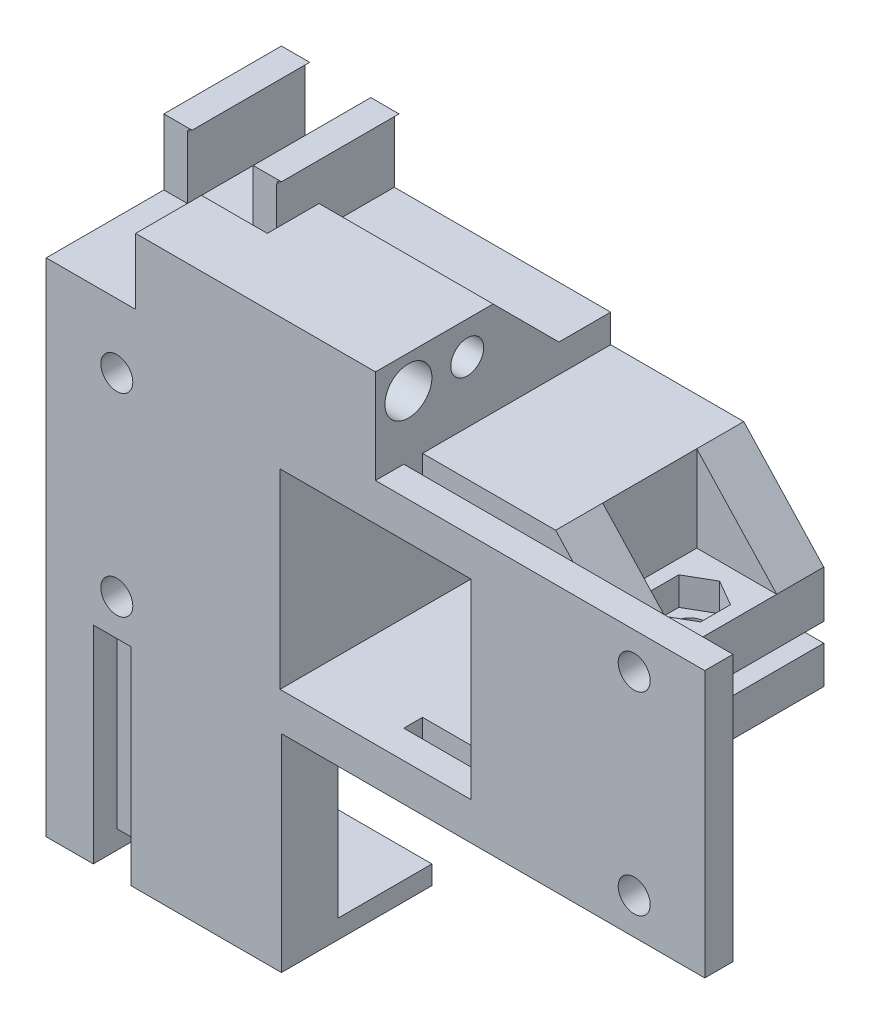
from build123d import *

# Parameters (mm, degrees)
ESQUISSE1_W                = 28.3
ESQUISSE1_H                = 28.3
ESQUISSE1_W_2              = 20.3
ESQUISSE1_H_2              = 20.3
BOSS_EXTRU_1_DEPTH         = 20
BOSS_EXTRU_7_DEPTH         = 20
ESQUISSE2_W                = 8.5
ESQUISSE2_H                = 20
ESQUISSE2_R                = 1.7
BOSS_EXTRU_2_DEPTH         = 2
ESQUISSE2_3_W              = 8.5
ESQUISSE2_3_H              = 20
BOSS_EXTRU_3_DEPTH         = 3
ESQUISSE3_W                = 8.5
ESQUISSE3_H                = 20
ESQUISSE3_R                = 1.7
BOSS_EXTRU_4_DEPTH         = 2
ESQUISSE5_W                = 8.5
ESQUISSE5_H                = 20
ESQUISSE5_R                = 3
BOSS_EXTRU_5_DEPTH         = 2
BOSS_EXTRU_6_DEPTH         = 20
BOSS_EXTRU_6_DEPTH_BACK    = 20
ESQUISSE6_W                = 28.3
ESQUISSE6_H                = 28.3
ESQUISSE6_W_2              = 15.3
ESQUISSE6_H_2              = 15.3
ENL_V_MAT_EXTRU_1_REACH    = 68.678
ESQUISSE7_W                = 6.5
ESQUISSE7_H                = 2
ENL_V_MAT_EXTRU_2_REACH    = 65.341
ESQUISSE8_W                = 14.15
ESQUISSE8_H                = 2
ESQUISSE9_W                = 8.5
ESQUISSE9_H                = 40
BOSS_EXTRU_8_DEPTH         = 5
ESQUISSE9_4_R              = 1.7
BOSS_EXTRU_9_DEPTH         = 2
BOSS_EXTRU_10_START        = -2
ESQUISSE10_W               = 8.5
ESQUISSE10_H               = 40
ESQUISSE10_R               = 1.7
BOSS_EXTRU_10_DEPTH        = 2
ESQUISSE11_W               = 8.5
ESQUISSE11_H               = 40
ESQUISSE11_R               = 3
BOSS_EXTRU_11_DEPTH        = 2
NERVURE4_REACH             = 68.678
ESQUISSE14_WALL_W          = 147.131281186
ESQUISSE14_WALL_H          = 5
NERVURE10_REACH            = 68.678
ESQUISSE16_WALL_W          = 147.844247416
ESQUISSE16_WALL_H          = 5
R_P_TITION_LIN_AIRE1_COUNT = 3
R_P_TITION_LIN_AIRE1_PITCH = 17.5
NERVURE11_REACH            = 76.685
ESQUISSE17_WALL_W          = 163.85974229
ESQUISSE17_WALL_H          = 5
NERVURE17_REACH            = 58.973
ESQUISSE19_WALL_W          = 127.721749296
ESQUISSE19_WALL_H          = 5
R_P_TITION_LIN_AIRE2_COUNT = 2
R_P_TITION_LIN_AIRE2_PITCH = 15
R_P_TITION_LIN_AIRE3_COUNT = 2
R_P_TITION_LIN_AIRE3_PITCH = 15
ENL_V_MAT_EXTRU_3_REACH    = 57.288
ESQUISSE20_W               = 77.833771897
ESQUISSE20_H               = 63.25162408
ESQUISSE21_W               = 14.15
ESQUISSE21_H               = 3.85
BOSS_EXTRU_12_DEPTH        = 3
BOSS_EXTRU_13_START        = 3
ESQUISSE23_W               = 20.85
ESQUISSE23_H               = 28.3
ESQUISSE23_R               = 1.7
BOSS_EXTRU_13_DEPTH        = 3
ESQUISSE24_W               = 25
ESQUISSE24_H               = 22
BOSS_EXTRU_14_DEPTH        = 6
ESQUISSE25_W               = 22
ESQUISSE25_H               = 18
ENL_V_MAT_EXTRU_4_DEPTH    = 2
ENL_V_MAT_EXTRU_5_REACH    = 55.785
ESQUISSE26_W               = 4
ESQUISSE26_H               = 2
ENL_V_MAT_EXTRU_6_REACH    = 64.912
ESQUISSE27_W               = 4
ESQUISSE27_H               = 2.5
ESQUISSE28_W               = 16
ESQUISSE28_H               = 2
ESQUISSE28_W_2             = 5
BOSS_EXTRU_15_DEPTH        = 10
ESQUISSE29_W               = 5
ESQUISSE29_H               = 2
ENL_V_MAT_EXTRU_7_DEPTH    = 2
ESQUISSE30_W               = 35
ESQUISSE30_H               = 25
BOSS_EXTRU_16_DEPTH        = 3
ESQUISSE31_W               = 2.5
ESQUISSE31_H               = 12.5
ESQUISSE31_W_2             = 18.5
ESQUISSE31_H_2             = 5.5
BOSS_EXTRU_17_DEPTH        = 7
ESQUISSE32_R               = 1.75
ESQUISSE32_R_2             = 2.5
ENL_V_MAT_EXTRU_8_DEPTH    = 74.260306442
CHANFREIN1_SIZE            = 7
BOSS_EXTRU_18_DEPTH        = 12.5


with BuildPart() as part:
    # Esquisse1 → Boss.-Extru.1 (new body)
    with BuildSketch(Plane.XY):
        Rectangle(ESQUISSE1_W, ESQUISSE1_H)
        Rectangle(ESQUISSE1_W_2, ESQUISSE1_H_2, mode=Mode.SUBTRACT)
    extrude(amount=BOSS_EXTRU_1_DEPTH)

    # Esquisse1<3> → Boss.-Extru.7 (add)
    with BuildSketch(Plane.XY):
        Polygon((14.15, 14.15), (-14.15, 14.15), (-14.15, -14.15), (14.15, -14.15), (14.15, -2), (10.15, -2), (10.15, -10.15), (-10.15, -10.15), (-10.15, 10.15), (10.15, 10.15), (10.15, 0), (14.15, 0), align=None)
    extrude(amount=-BOSS_EXTRU_7_DEPTH)

    # Esquisse2 → Boss.-Extru.2 (add)
    with BuildSketch(Plane(origin=(0, 2, 0), x_dir=(-1, 0, 0), z_dir=(0, -1, 0))):
        with Locations((-18.4, 10)):
            Rectangle(ESQUISSE2_W, ESQUISSE2_H)
        with Locations(Location((-18.4, 10, 0), (0, 0, 180))):
            Circle(ESQUISSE2_R, mode=Mode.SUBTRACT)
    extrude(amount=BOSS_EXTRU_2_DEPTH)

    # Esquisse2<3> → Boss.-Extru.3 (add)
    with BuildSketch(Plane(origin=(0, 2, 0), x_dir=(-1, 0, 0), z_dir=(0, -1, 0))):
        with Locations((-18.4, 10)):
            Rectangle(ESQUISSE2_3_W, ESQUISSE2_3_H)
        Polygon((-15.65, 11.58771324), (-15.65, 8.41228676), (-18.4, 6.824573519), (-21.15, 8.41228676), (-21.15, 11.58771324), (-18.4, 13.175426481), align=None, mode=Mode.SUBTRACT)
    extrude(amount=-BOSS_EXTRU_3_DEPTH)

    # Esquisse3 → Boss.-Extru.4 (add)
    with BuildSketch(Plane(origin=(0, -2, 0), x_dir=(1, 0, 0), z_dir=(0, 1, 0))):
        with Locations((18.4, 10)):
            Rectangle(ESQUISSE3_W, ESQUISSE3_H)
        with Locations((18.4, 10)):
            Circle(ESQUISSE3_R, mode=Mode.SUBTRACT)
    extrude(amount=-BOSS_EXTRU_4_DEPTH)

    # Esquisse5 → Boss.-Extru.5 (add)
    with BuildSketch(Plane.XZ.offset(4)):
        with Locations((18.4, -10)):
            Rectangle(ESQUISSE5_W, ESQUISSE5_H)
        with Locations((18.4, -10)):
            Circle(ESQUISSE5_R, mode=Mode.SUBTRACT)
    extrude(amount=BOSS_EXTRU_5_DEPTH)

    # Esquisse6 → Boss.-Extru.6 (add, two sides: drawn at the far end of the back side and taken through both)
    with BuildSketch(Plane(origin=(0, 0, 0), x_dir=(-1, 0, 0), z_dir=(0, -1, 0)).offset(-BOSS_EXTRU_6_DEPTH_BACK)):
        with Locations((0, -34.15)):
            Rectangle(ESQUISSE6_W, ESQUISSE6_H)
        with Locations((0, -34.15)):
            Rectangle(ESQUISSE6_W_2, ESQUISSE6_H_2, mode=Mode.SUBTRACT)
    extrude(amount=BOSS_EXTRU_6_DEPTH + BOSS_EXTRU_6_DEPTH_BACK)

    # Esquisse7 → Enlèv. mat.-Extru.1 (cut, up to next)
    with BuildSketch(Plane.XZ.offset(20), mode=Mode.PRIVATE) as enl_v_mat_extru_1_sk1:
        with Locations((10.9, 35.15)):
            Rectangle(ESQUISSE7_W, ESQUISSE7_H)
    enl_v_mat_extru_1_tool1 = extrude(enl_v_mat_extru_1_sk1.sketch, amount=-ENL_V_MAT_EXTRU_1_REACH, mode=Mode.PRIVATE) & part.part
    add(enl_v_mat_extru_1_tool1.solids().sort_by_distance((10.9, -20, 35.15))[0], mode=Mode.SUBTRACT)

    # Esquisse8 → Enlèv. mat.-Extru.2 (cut, up to next)
    with BuildSketch(Plane.XZ.offset(14.15), mode=Mode.PRIVATE) as enl_v_mat_extru_2_sk1:
        with Locations((7.075, 1)):
            Rectangle(ESQUISSE8_W, ESQUISSE8_H)
    enl_v_mat_extru_2_tool1 = extrude(enl_v_mat_extru_2_sk1.sketch, amount=-ENL_V_MAT_EXTRU_2_REACH, mode=Mode.PRIVATE) & part.part
    add(enl_v_mat_extru_2_tool1.solids().sort_by_distance((7.075, -14.15, 1))[0], mode=Mode.SUBTRACT)

    # Esquisse9 → Boss.-Extru.8 (add)
    with BuildSketch(Plane.XY.offset(34.15)):
        with Locations((18.4, 0)):
            Rectangle(ESQUISSE9_W, ESQUISSE9_H)
        Polygon((18.4, 6.824573519), (21.15, 8.41228676), (21.15, 11.58771324), (18.4, 13.175426481), (15.65, 11.58771324), (15.65, 8.41228676), align=None, mode=Mode.SUBTRACT)
        Polygon((18.4, -6.824573519), (21.15, -8.41228676), (21.15, -11.58771324), (18.4, -13.175426481), (15.65, -11.58771324), (15.65, -8.41228676), align=None, mode=Mode.SUBTRACT)
    extrude(amount=-BOSS_EXTRU_8_DEPTH)

    # Esquisse9<4> → Boss.-Extru.9 (add)
    # profile 1 of 2: a face of its own
    with BuildSketch(Plane.XY.offset(34.15)):
        Polygon((15.65, 8.41228676), (18.4, 6.824573519), (21.15, 8.41228676), (21.15, 11.58771324), (18.4, 13.175426481), (15.65, 11.58771324), align=None)
        with Locations((18.4, 10)):
            Circle(ESQUISSE9_4_R, mode=Mode.SUBTRACT)
    # profile 2 of 2: a face of its own
    with BuildSketch(Plane.XY.offset(34.15)):
        Polygon((21.15, -8.41228676), (21.15, -11.58771324), (18.4, -13.175426481), (15.65, -11.58771324), (15.65, -8.41228676), (18.4, -6.824573519), align=None)
        with Locations((18.4, -10)):
            Circle(ESQUISSE9_4_R, mode=Mode.SUBTRACT)
    extrude(amount=-BOSS_EXTRU_9_DEPTH)

    # Esquisse10 → Boss.-Extru.10 (add)
    with BuildSketch(Plane(origin=(0, 0, 36.15), x_dir=(-1, 0, 0), z_dir=(0, 0, -1)).offset(BOSS_EXTRU_10_START)):
        with Locations((-18.4, 0)):
            Rectangle(ESQUISSE10_W, ESQUISSE10_H)
        with Locations(Location((-18.4, -10, 0), (0, 0, 180))):
            Circle(ESQUISSE10_R, mode=Mode.SUBTRACT)
        with Locations(Location((-18.4, 10, 0), (0, 0, 180))):
            Circle(ESQUISSE10_R, mode=Mode.SUBTRACT)
    extrude(amount=BOSS_EXTRU_10_DEPTH)

    # Esquisse11 → Boss.-Extru.11 (add)
    with BuildSketch(Plane.XY.offset(38.15)):
        with Locations((18.4, 0)):
            Rectangle(ESQUISSE11_W, ESQUISSE11_H)
        with Locations((18.4, 10)):
            Circle(ESQUISSE11_R, mode=Mode.SUBTRACT)
        with Locations((18.4, -10)):
            Circle(ESQUISSE11_R, mode=Mode.SUBTRACT)
    extrude(amount=BOSS_EXTRU_11_DEPTH)

    # Esquisse14 wall → Nervure4 (add, up to next)
    with BuildSketch(Plane(origin=(18.4, -20, 44.225), x_dir=(0.721811427095, 0, -0.692089780097), z_dir=(0.692089780097, 0, 0.721811427095)), mode=Mode.PRIVATE) as nervure4_sk1:
        with Locations((0, 2.5)):
            Rectangle(ESQUISSE14_WALL_W, ESQUISSE14_WALL_H)
    nervure4_tool1 = extrude(nervure4_sk1.sketch, amount=-NERVURE4_REACH, mode=Mode.PRIVATE) - part.part
    nervure4 = nervure4_tool1.solids().sort_by_distance((18.4, -20, 44.225))[0]
    add(nervure4)

    # Esquisse16 wall → Nervure10 (add, up to next)
    with BuildSketch(Plane(origin=(18.4, -20, 24.575), x_dir=(-0.680604645507, 0, -0.732650883105), z_dir=(0.732650883105, 0, -0.680604645507)), mode=Mode.PRIVATE) as nervure10_sk1:
        with Locations((0, 2.5)):
            Rectangle(ESQUISSE16_WALL_W, ESQUISSE16_WALL_H)
    nervure10_tool1 = extrude(nervure10_sk1.sketch, amount=-NERVURE10_REACH, mode=Mode.PRIVATE) - part.part
    nervure10 = nervure10_tool1.solids().sort_by_distance((18.4, -20, 24.575))[0]
    add(nervure10)

    # Répétition linéaire1: Nervure4, Nervure10 ×3
    with Locations(*[(0, i * R_P_TITION_LIN_AIRE1_PITCH, 0) for i in range(1, R_P_TITION_LIN_AIRE1_COUNT)]):
        add(nervure4)
        add(nervure10)

    # Esquisse17 wall → Nervure11 (add, up to next)
    with BuildSketch(Plane(origin=(18.4, 9.575, -20), x_dir=(-0.680604645507, 0.732650883105, 0), z_dir=(0.732650883105, 0.680604645507, 0)), mode=Mode.PRIVATE) as nervure11_sk1:
        with Locations((0, 2.5)):
            Rectangle(ESQUISSE17_WALL_W, ESQUISSE17_WALL_H)
    nervure11_tool1 = extrude(nervure11_sk1.sketch, amount=-NERVURE11_REACH, mode=Mode.PRIVATE) - part.part
    nervure11 = nervure11_tool1.solids().sort_by_distance((18.4, 9.575, -20))[0]
    add(nervure11)

    # Esquisse19 wall → Nervure17 (add, up to next)
    with BuildSketch(Plane(origin=(18.4, -10.075, 0), x_dir=(-0.721811427095, -0.692089780097, 0), z_dir=(0.692089780097, -0.721811427095, 0)), mode=Mode.PRIVATE) as nervure17_sk1:
        with Locations((0, 2.5)):
            Rectangle(ESQUISSE19_WALL_W, ESQUISSE19_WALL_H)
    nervure17_tool1 = extrude(nervure17_sk1.sketch, amount=-NERVURE17_REACH, mode=Mode.PRIVATE) - part.part
    nervure17 = nervure17_tool1.solids().sort_by_distance((18.4, -10.075, 0))[0]
    add(nervure17)

    # Répétition linéaire2: Nervure17 ×2
    with Locations(*[(0, 0, -i * R_P_TITION_LIN_AIRE2_PITCH) for i in range(1, R_P_TITION_LIN_AIRE2_COUNT)]):
        add(nervure17)

    # Répétition linéaire3: Nervure11 ×2
    with Locations(*[(0, 0, i * R_P_TITION_LIN_AIRE3_PITCH) for i in range(1, R_P_TITION_LIN_AIRE3_COUNT)]):
        add(nervure11)

    # Esquisse20 → Enlèv. mat.-Extru.3 (cut, up to next)
    with BuildSketch(Plane(origin=(0, 0, 2), x_dir=(-1, 0, 0), z_dir=(0, 0, -1)), mode=Mode.PRIVATE) as enl_v_mat_extru_3_sk1:
        with Locations((6.593135557, -7.228757038)):
            Rectangle(ESQUISSE20_W, ESQUISSE20_H)
    enl_v_mat_extru_3_tool1 = extrude(enl_v_mat_extru_3_sk1.sketch, amount=-ENL_V_MAT_EXTRU_3_REACH, mode=Mode.PRIVATE) & part.part
    add(enl_v_mat_extru_3_tool1.solids().sort_by_distance((-6.593136, -7.228757, 2))[0], mode=Mode.SUBTRACT)

    # Esquisse21 → Boss.-Extru.12 (add)
    with BuildSketch(Plane.XY.offset(2)):
        with BuildLine():
            ThreePointArc((-27.5, 8.6), (-28.702081528, 11.502081528), (-25.8, 10.3))
            Line((-25.8, 10.3), (-14.15, 10.3))
            Line((-14.15, 10.3), (-14.15, 14.15))
            Line((-14.15, 14.15), (-35, 14.15))
            Line((-35, 14.15), (-35, -14.15))
            Line((-35, -14.15), (-14.15, -14.15))
            Line((-14.15, -14.15), (-14.15, -10.3))
            Line((-14.15, -10.3), (-25.8, -10.3))
            ThreePointArc((-25.8, -10.3), (-28.702081528, -11.502081528), (-27.5, -8.6))
            Line((-27.5, -8.6), (-27.5, 8.6))
        make_face()
        with BuildLine():
            Line((-14.15, 10.3), (-25.8, 10.3))
            ThreePointArc((-25.8, 10.3), (-26.297918472, 9.097918472), (-27.5, 8.6))
            Line((-27.5, 8.6), (-27.5, -8.6))
            ThreePointArc((-27.5, -8.6), (-26.297918472, -9.097918472), (-25.8, -10.3))
            Line((-25.8, -10.3), (-14.15, -10.3))
            Line((-14.15, -10.3), (-14.15, 10.3))
        make_face()
        with BuildLine():
            Line((0, 14.15), (0, 10.3))
            Line((0, 10.3), (25.8, 10.3))
            ThreePointArc((25.8, 10.3), (27.5, 12), (29.2, 10.3))
            ThreePointArc((29.2, 10.3), (28.702081528, 9.097918472), (27.5, 8.6))
            Line((27.5, 8.6), (27.5, -8.6))
            ThreePointArc((27.5, -8.6), (28.702081528, -9.097918472), (29.2, -10.3))
            ThreePointArc((29.2, -10.3), (27.5, -12), (25.8, -10.3))
            Line((25.8, -10.3), (0, -10.3))
            Line((0, -10.3), (0, -14.15))
            Line((0, -14.15), (35, -14.15))
            Line((35, -14.15), (35, 14.15))
            Line((35, 14.15), (0, 14.15))
        make_face()
        with Locations((-7.075, 12.225)):
            Rectangle(ESQUISSE21_W, ESQUISSE21_H)
        Polygon((0, 10.3), (-14.15, 10.3), (-14.15, -10.3), (0, -10.3), (0, -10.15), (-10.15, -10.15), (-10.15, 10.15), (0, 10.15), align=None)
        with Locations((-7.075, -12.225)):
            Rectangle(ESQUISSE21_W, ESQUISSE21_H)
        with BuildLine():
            Line((25.8, 10.3), (0, 10.3))
            Line((0, 10.3), (0, 10.15))
            Line((0, 10.15), (10.15, 10.15))
            Line((10.15, 10.15), (10.15, -10.15))
            Line((10.15, -10.15), (0, -10.15))
            Line((0, -10.15), (0, -10.3))
            Line((0, -10.3), (25.8, -10.3))
            ThreePointArc((25.8, -10.3), (26.297918472, -9.097918472), (27.5, -8.6))
            Line((27.5, -8.6), (27.5, 8.6))
            ThreePointArc((27.5, 8.6), (26.297918472, 9.097918472), (25.8, 10.3))
        make_face()
    extrude(amount=BOSS_EXTRU_12_DEPTH)

    # Esquisse23 → Boss.-Extru.13 (add)
    with BuildSketch(Plane(origin=(0, 0, 2), x_dir=(-1, 0, 0), z_dir=(0, 0, -1)).offset(BOSS_EXTRU_13_START)):
        with Locations((24.575, 0)):
            Rectangle(ESQUISSE23_W, ESQUISSE23_H)
        with Locations((27.5, 10.3)):
            Circle(ESQUISSE23_R, mode=Mode.SUBTRACT)
        with Locations((27.5, -10.3)):
            Circle(ESQUISSE23_R, mode=Mode.SUBTRACT)
    extrude(amount=-BOSS_EXTRU_13_DEPTH)

    # Esquisse24 → Boss.-Extru.14 (add)
    with BuildSketch(Plane.XY.offset(5)):
        with Locations((-22.5, -25.15)):
            Rectangle(ESQUISSE24_W, ESQUISSE24_H)
    extrude(amount=-BOSS_EXTRU_14_DEPTH)

    # Esquisse25 → Enlèv. mat.-Extru.4 (cut)
    with BuildSketch(Plane(origin=(0, 0, -1), x_dir=(-1, 0, 0), z_dir=(0, 0, -1))):
        with Locations((22, -25.15)):
            Rectangle(ESQUISSE25_W, ESQUISSE25_H)
    extrude(amount=-ENL_V_MAT_EXTRU_4_DEPTH, mode=Mode.SUBTRACT)

    # Esquisse26 → Enlèv. mat.-Extru.5 (cut, up to next)
    with BuildSketch(Plane(origin=(0, 0, -1), x_dir=(-1, 0, 0), z_dir=(0, 0, -1)), mode=Mode.PRIVATE) as enl_v_mat_extru_5_sk1:
        with Locations((28, -15.15)):
            Rectangle(ESQUISSE26_W, ESQUISSE26_H)
    enl_v_mat_extru_5_tool1 = extrude(enl_v_mat_extru_5_sk1.sketch, amount=-ENL_V_MAT_EXTRU_5_REACH, mode=Mode.PRIVATE) & part.part
    # Esquisse26 → Enlèv. mat.-Extru.5 (cut, up to next)
    with BuildSketch(Plane(origin=(0, 0, -1), x_dir=(-1, 0, 0), z_dir=(0, 0, -1)), mode=Mode.PRIVATE) as enl_v_mat_extru_5_sk2:
        with Locations((28, -35.15)):
            Rectangle(ESQUISSE26_W, ESQUISSE26_H)
    enl_v_mat_extru_5_tool2 = extrude(enl_v_mat_extru_5_sk2.sketch, amount=-ENL_V_MAT_EXTRU_5_REACH, mode=Mode.PRIVATE) & part.part
    add(enl_v_mat_extru_5_tool1.solids().sort_by_distance((-28, -15.15, -1))[0], mode=Mode.SUBTRACT)
    add(enl_v_mat_extru_5_tool2.solids().sort_by_distance((-28, -35.15, -1))[0], mode=Mode.SUBTRACT)

    # Esquisse27 → Enlèv. mat.-Extru.6 (cut, up to next)
    with BuildSketch(Plane.XZ.offset(34.15), mode=Mode.PRIVATE) as enl_v_mat_extru_6_sk1:
        with Locations((-28, 3.75)):
            Rectangle(ESQUISSE27_W, ESQUISSE27_H)
    enl_v_mat_extru_6_tool1 = extrude(enl_v_mat_extru_6_sk1.sketch, amount=-ENL_V_MAT_EXTRU_6_REACH, mode=Mode.PRIVATE) & part.part
    add(enl_v_mat_extru_6_tool1.solids().sort_by_distance((-28, -34.15, 3.75))[0], mode=Mode.SUBTRACT)

    # Esquisse28 → Boss.-Extru.15 (add)
    with BuildSketch(Plane(origin=(0, 0, -1), x_dir=(-1, 0, 0), z_dir=(0, 0, -1))):
        with Locations((18, -15.15)):
            Rectangle(ESQUISSE28_W, ESQUISSE28_H)
        with Locations((32.5, -15.15)):
            Rectangle(ESQUISSE28_W_2, ESQUISSE28_H)
        with Locations((32.5, -35.15)):
            Rectangle(ESQUISSE28_W_2, ESQUISSE28_H)
        with Locations((18, -35.15)):
            Rectangle(ESQUISSE28_W, ESQUISSE28_H)
    extrude(amount=BOSS_EXTRU_15_DEPTH)

    # Esquisse29 → Enlèv. mat.-Extru.7 (cut)
    with BuildSketch(Plane(origin=(0, 0, -11), x_dir=(-1, 0, 0), z_dir=(0, 0, -1))):
        with Locations((32.5, -35.15)):
            Rectangle(ESQUISSE29_W, ESQUISSE29_H)
    extrude(amount=-ENL_V_MAT_EXTRU_7_DEPTH, mode=Mode.SUBTRACT)

    # Esquisse30 → Boss.-Extru.16 (add)
    with BuildSketch(Plane(origin=(0, 14.15, 0), x_dir=(1, 0, 0), z_dir=(0, 1, 0))):
        with Locations((-17.5, 7.5)):
            Rectangle(ESQUISSE30_W, ESQUISSE30_H)
    extrude(amount=BOSS_EXTRU_16_DEPTH)

    # Esquisse31 → Boss.-Extru.17 (add)
    with BuildSketch(Plane(origin=(0, 17.15, 0), x_dir=(1, 0, 0), z_dir=(0, 1, 0))):
        with Locations((-33.75, 13.75)):
            Rectangle(ESQUISSE31_W, ESQUISSE31_H)
        with Locations((-24.25, 13.75)):
            Rectangle(ESQUISSE31_W, ESQUISSE31_H)
        with Locations((-9.25, 4.75)):
            Rectangle(ESQUISSE31_W_2, ESQUISSE31_H_2)
        Polygon((-25.5, 2), (-25.5, -5), (0, -5), (0, 2), (-18.5, 2), align=None)
    extrude(amount=BOSS_EXTRU_17_DEPTH)

    # Esquisse32 → Enlèv. mat.-Extru.8 (cut, through all)
    with BuildSketch(Plane.ZY.offset(25.5)):
        with Locations(Location((-4.75, 20.65, 0), (0, 0, 270))):
            Circle(ESQUISSE32_R)
        with Locations((1.5, 20.65)):
            Circle(ESQUISSE32_R_2)
    extrude(amount=-ENL_V_MAT_EXTRU_8_DEPTH, mode=Mode.SUBTRACT)

    # Chanfrein1
    chanfrein1_edges = [part.edges().sort_by_distance(p)[0] for p in [
        (-9.25, 17.15, -7.5),
    ]]
    chamfer(chanfrein1_edges, length=CHANFREIN1_SIZE - 0.0001)  # a hair under: the kernel refuses the full size

    # Esquisse34 → Boss.-Extru.18 (add)
    with BuildSketch(Plane(origin=(0, 0, -20), x_dir=(-1, 0, 0), z_dir=(0, 0, -1))):
        with BuildLine():
            Line((23, 24.15), (22.5, 24.15))
            ThreePointArc((22.5, 24.15), (22.853553391, 24.003553391), (23, 23.65))
            Line((23, 23.65), (23, 24.15))
        make_face()
        with BuildLine():
            Line((32.5, 24.15), (32.5, 23.65))
            ThreePointArc((32.5, 23.65), (32.353553391, 24.003553391), (32, 24.15))
            Line((32, 24.15), (32.5, 24.15))
        make_face()
    extrude(amount=-BOSS_EXTRU_18_DEPTH)


solid = part.part
